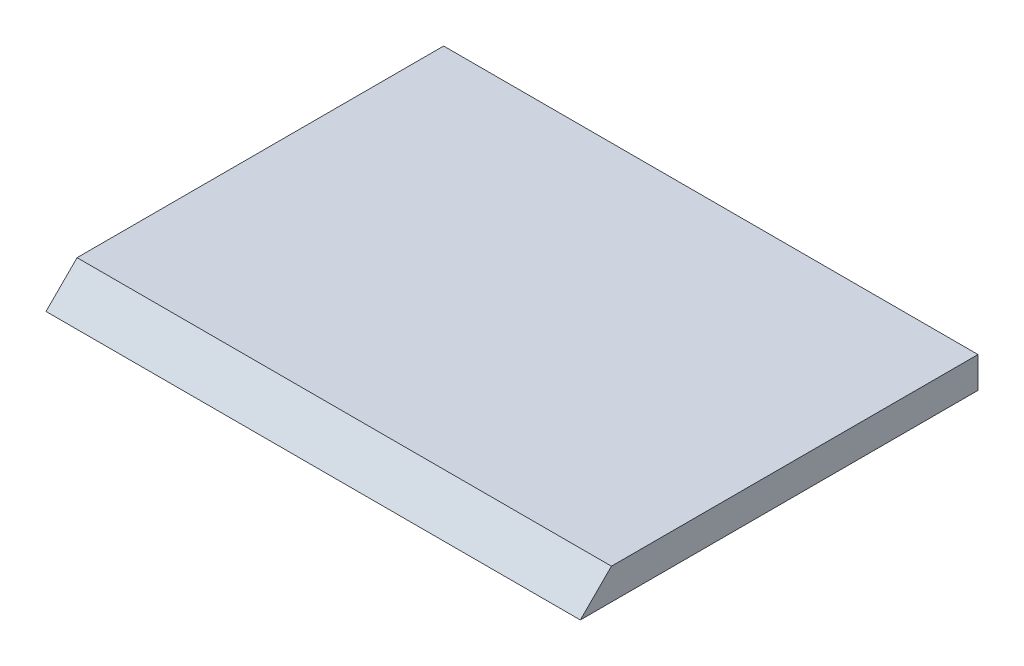
from build123d import *

# Parameters (mm, degrees)
SKETCH1_W           = 10.922
SKETCH1_H           = 8.128
BOSS_EXTRUDE1_DEPTH = 0.635
CHAMFER1_SIZE       = 0.635


with BuildPart() as part:
    # Sketch1 → Boss-Extrude1 (new body)
    with BuildSketch(Plane(origin=(0, 0, 0), x_dir=(1, 0, 0), z_dir=(0, 1, 0))):
        Rectangle(SKETCH1_W, SKETCH1_H)
    extrude(amount=BOSS_EXTRUDE1_DEPTH)

    # Chamfer1
    chamfer1_edges = [part.edges().sort_by_distance(p)[0] for p in [
        (0, 0.635, 4.064),
    ]]
    chamfer(chamfer1_edges, length=CHAMFER1_SIZE - 0.0001)  # a hair under: the kernel refuses the full size


solid = part.part
